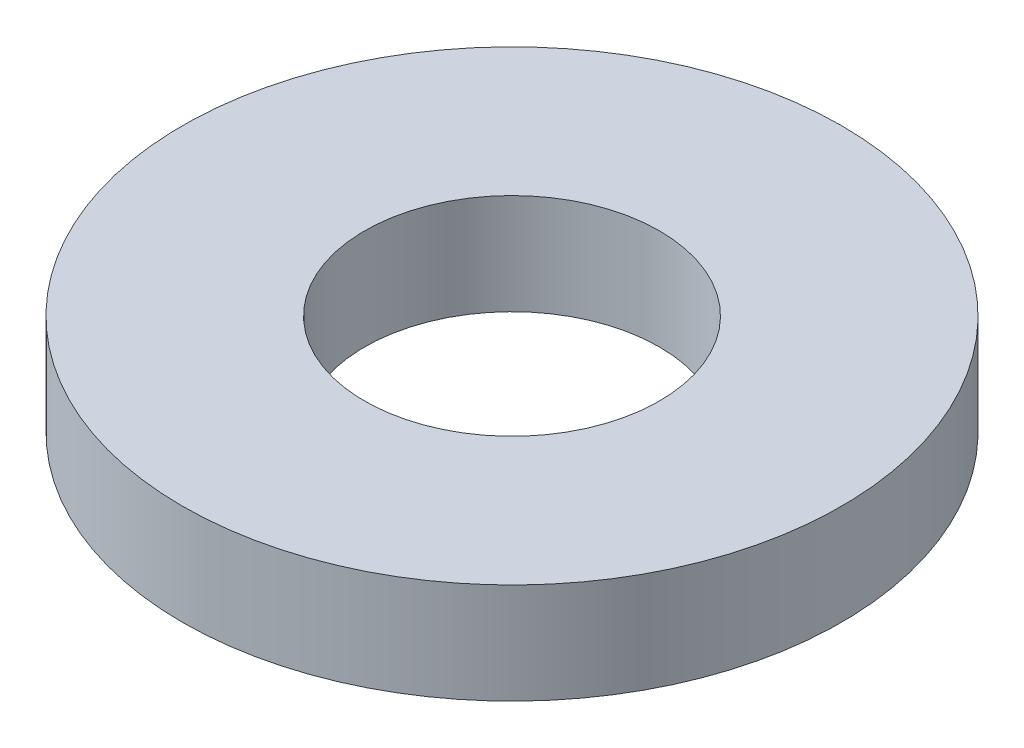
from build123d import *

# Parameters (mm, degrees)
SKETCH1_R           = 95
BOSS_EXTRUDE1_DEPTH = 29
SKETCH2_R           = 42.5
CUT_EXTRUDE1_DEPTH  = 138.444534267


with BuildPart() as part:
    # Sketch1 → Boss-Extrude1 (new body)
    with BuildSketch(Plane(origin=(0, 0, 0), x_dir=(1, 0, 0), z_dir=(0, 1, 0))):
        Circle(SKETCH1_R)
    extrude(amount=BOSS_EXTRUDE1_DEPTH)

    # Sketch2 → Cut-Extrude1 (cut, through all)
    with BuildSketch(Plane(origin=(0, 0, 0), x_dir=(1, 0, 0), z_dir=(0, 1, 0))):
        Circle(SKETCH2_R)
    extrude(amount=CUT_EXTRUDE1_DEPTH, mode=Mode.SUBTRACT)


solid = part.part
